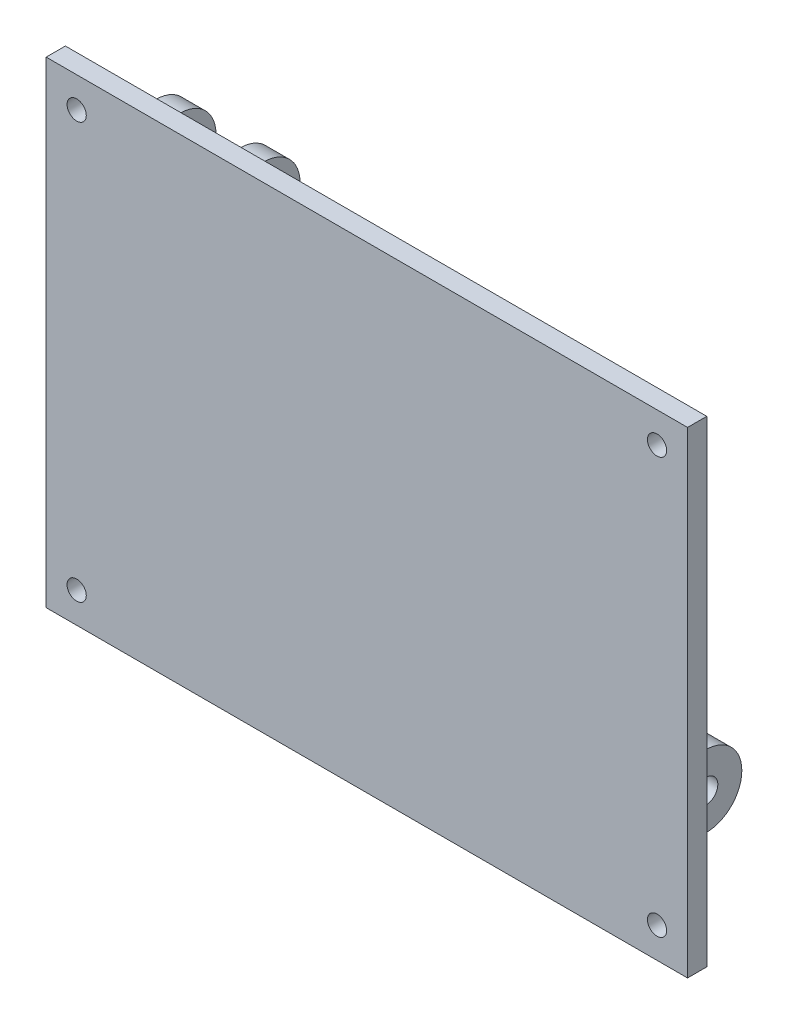
from build123d import *

# Parameters (mm, degrees)
SKETCH1_R               = 4
SKETCH1_W               = 10
SKETCH1_H               = 30
BOSS_EXTRUDE1_DEPTH     = 8
SKETCH1_3_W             = 10
SKETCH1_3_H             = 30
BOSS_EXTRUDE2_DEPTH     = 40
FILLET1_R               = 3
CUT_EXTRUDE1_DEPTH      = 262.951140482
CUT_EXTRUDE1_DEPTH_BACK = 262.951140482
SKETCH2_R               = 5
SKETCH2_R_2             = 4
FILLET2_R               = 15
FILLET3_R               = 15


with BuildPart() as part:
    # Sketch1 → Boss-Extrude1 (new body)
    # profile 1 of 7: a face of its own
    with BuildSketch(Plane.XY):
        Polygon((-152.7, -38.1), (-114.3, -38.1), (114.3, -38.1), (114.3, 38.1), (114.3, 160.4), (-114.3, 160.4), (-152.7, 160.4), align=None)
        with Locations((-140, -25.4)):
            Circle(SKETCH1_R, mode=Mode.SUBTRACT)
        with Locations((-83.9, 0)):
            Rectangle(SKETCH1_W, SKETCH1_H, mode=Mode.SUBTRACT)
        with Locations((-53.9, 0)):
            Rectangle(SKETCH1_W, SKETCH1_H, mode=Mode.SUBTRACT)
        with Locations((101.6, -25.4)):
            Circle(SKETCH1_R, mode=Mode.SUBTRACT)
        with Locations((53.9, 0)):
            Rectangle(SKETCH1_W, SKETCH1_H, mode=Mode.SUBTRACT)
        with Locations((83.9, 0)):
            Rectangle(SKETCH1_W, SKETCH1_H, mode=Mode.SUBTRACT)
        with Locations((-135, 120)):
            Rectangle(SKETCH1_W, SKETCH1_H, mode=Mode.SUBTRACT)
        with Locations((-100, 120)):
            Rectangle(SKETCH1_W, SKETCH1_H, mode=Mode.SUBTRACT)
        with Locations((-140, 147.7)):
            Circle(SKETCH1_R, mode=Mode.SUBTRACT)
        with Locations((101.6, 147.7)):
            Circle(SKETCH1_R, mode=Mode.SUBTRACT)
    # profile 2 of 7: a face of its own
    with BuildSketch(Plane.XY):
        with Locations((-53.9, 0)):
            Rectangle(SKETCH1_W, SKETCH1_H)
    # profile 3 of 7: a face of its own
    with BuildSketch(Plane.XY):
        with Locations((-83.9, 0)):
            Rectangle(SKETCH1_W, SKETCH1_H)
    # profile 4 of 7: a face of its own
    with BuildSketch(Plane.XY):
        with Locations((53.9, 0)):
            Rectangle(SKETCH1_W, SKETCH1_H)
    # profile 5 of 7: a face of its own
    with BuildSketch(Plane.XY):
        with Locations((83.9, 0)):
            Rectangle(SKETCH1_W, SKETCH1_H)
    # profile 6 of 7: a face of its own
    with BuildSketch(Plane.XY):
        with Locations((-100, 120)):
            Rectangle(SKETCH1_W, SKETCH1_H)
    # profile 7 of 7: a face of its own
    with BuildSketch(Plane.XY):
        with Locations((-135, 120)):
            Rectangle(SKETCH1_W, SKETCH1_H)
    extrude(amount=BOSS_EXTRUDE1_DEPTH)

    # Sketch1<3> → Boss-Extrude2 (add)
    with BuildSketch(Plane.XY):
        with Locations((-83.9, 0)):
            Rectangle(SKETCH1_3_W, SKETCH1_3_H)
        with Locations((-53.9, 0)):
            Rectangle(SKETCH1_3_W, SKETCH1_3_H)
        with Locations((83.9, 0)):
            Rectangle(SKETCH1_3_W, SKETCH1_3_H)
        with Locations((53.9, 0)):
            Rectangle(SKETCH1_3_W, SKETCH1_3_H)
        with Locations((-100, 120)):
            Rectangle(SKETCH1_3_W, SKETCH1_3_H)
        with Locations((-135, 120)):
            Rectangle(SKETCH1_3_W, SKETCH1_3_H)
    extrude(amount=-BOSS_EXTRUDE2_DEPTH)

    # Fillet1
    fillet1_edges = [part.edges().sort_by_distance(p)[0] for p in [
        (-83.9, 15, 0),
        (-88.9, 0, 0),
        (-83.9, -15, 0),
        (-48.9, 0, 0),
        (-53.9, 15, 0),
        (-53.9, -15, 0),
        (88.9, 0, 0),
        (83.9, -15, 0),
        (83.9, 15, 0),
        (53.9, -15, 0),
        (53.9, 15, 0),
        (48.9, 0, 0),
    ]]
    fillet(fillet1_edges, radius=FILLET1_R)

    # Sketch2 → Cut-Extrude1 (cut, two sides: drawn at the far end of the back side and taken through both)
    with BuildSketch(Plane.ZY.offset(88.9).offset(-CUT_EXTRUDE1_DEPTH_BACK)):
        with Locations((-25, 0)):
            Circle(SKETCH2_R)
        with Locations((-25, 120)):
            Circle(SKETCH2_R_2)
    extrude(amount=CUT_EXTRUDE1_DEPTH + CUT_EXTRUDE1_DEPTH_BACK, mode=Mode.SUBTRACT)

    # Fillet2
    fillet2_edges = [part.edges().sort_by_distance(p)[0] for p in [
        (53.9, 15, -40),
        (53.9, -15, -40),
        (83.9, 15, -40),
        (83.9, -15, -40),
        (-53.9, 15, -40),
        (-53.9, -15, -40),
        (-83.9, -15, -40),
        (-83.9, 15, -40),
    ]]
    fillet(fillet2_edges, radius=FILLET2_R - 0.0001)  # a hair under: the kernel refuses the full size

    # Fillet3
    fillet3_edges = [part.edges().sort_by_distance(p)[0] for p in [
        (-135, 135, -40),
        (-135, 105, -40),
        (-100, 105, -40),
        (-100, 135, -40),
    ]]
    fillet(fillet3_edges, radius=FILLET3_R - 0.0001)  # a hair under: the kernel refuses the full size


solid = part.part
